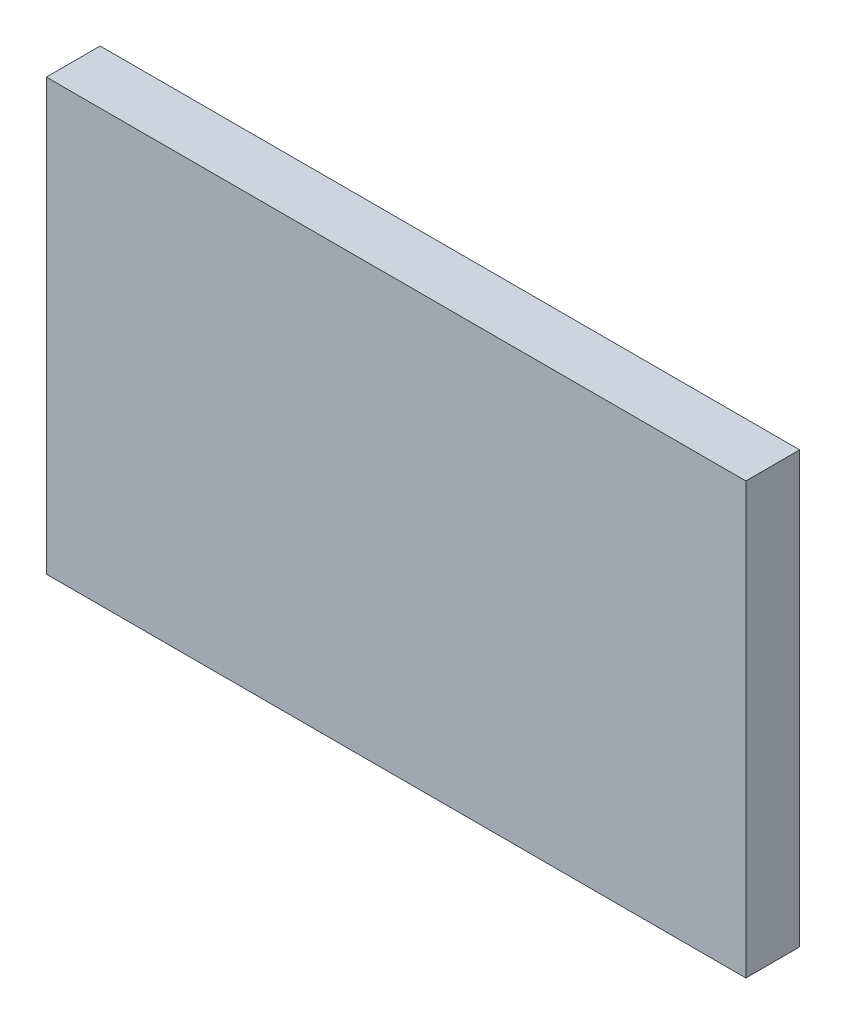
from build123d import *

# Parameters (mm, degrees)
SKETCH1_W            = 15
SKETCH1_H            = 20
BOSS_EXTRUDE1_DEPTH  = 230
SKETCH2_W            = 65
SKETCH2_H            = 40
BOSS_EXTRUDE6_DEPTH  = 5
SKETCH7_W            = 75
SKETCH7_H            = 15
BOSS_EXTRUDE7_DEPTH  = 5
SKETCH8_W            = 75
SKETCH8_H            = 15
BOSS_EXTRUDE8_DEPTH  = 5
SKETCH9_W            = 65
SKETCH9_H            = 40
BOSS_EXTRUDE11_DEPTH = 5
CUT_EXTRUDE1_DEPTH   = 240.635139326


with BuildPart() as part:
    # Sketch1 → Boss-Extrude1 (new body)
    with BuildSketch(Plane.XY):
        Rectangle(SKETCH1_W, SKETCH1_H)
    extrude(amount=BOSS_EXTRUDE1_DEPTH)

    # Sketch10 → Cut-Extrude1 (cut, through all)
    with BuildSketch(Plane.ZY.offset(7.5)):
        with BuildLine():
            Line((209.843145751, 2), (211.343145751, 2))
            ThreePointArc((211.343145751, 2), (223, 0), (211.343145751, -2))
            Line((211.343145751, -2), (209.843145751, -2))
            Line((209.843145751, -2), (209.843145751, 2))
        make_face()
    extrude(amount=-CUT_EXTRUDE1_DEPTH, mode=Mode.SUBTRACT)


with BuildPart() as body_2:
    # Sketch2 → Boss-Extrude6 (new body)
    with BuildSketch(Plane(origin=(0, 0, 0), x_dir=(-1, 0, 0), z_dir=(0, 0, -1))):
        with Locations((0, 30)):
            Rectangle(SKETCH2_W, SKETCH2_H)
    extrude(amount=-BOSS_EXTRUDE6_DEPTH)


with BuildPart() as body_3:
    # Sketch7 → Boss-Extrude7 (new body)
    with BuildSketch(Plane(origin=(32.5, 0, 0), x_dir=(0, 0, -1), z_dir=(1, 0, 0))):
        with Locations((-37.5, 30)):
            Rectangle(SKETCH7_W, SKETCH7_H)
    extrude(amount=BOSS_EXTRUDE7_DEPTH)


with BuildPart() as body_4:
    # Sketch8 → Boss-Extrude8 (new body)
    with BuildSketch(Plane.ZY.offset(32.5)):
        with Locations((37.5, 30)):
            Rectangle(SKETCH8_W, SKETCH8_H)
    extrude(amount=BOSS_EXTRUDE8_DEPTH)


with BuildPart() as body_5:
    # Sketch9 → Boss-Extrude11 (new body)
    with BuildSketch(Plane.XY.offset(75)):
        with Locations((0, 30)):
            Rectangle(SKETCH9_W, SKETCH9_H)
    extrude(amount=-BOSS_EXTRUDE11_DEPTH)


solid = body_5.part
